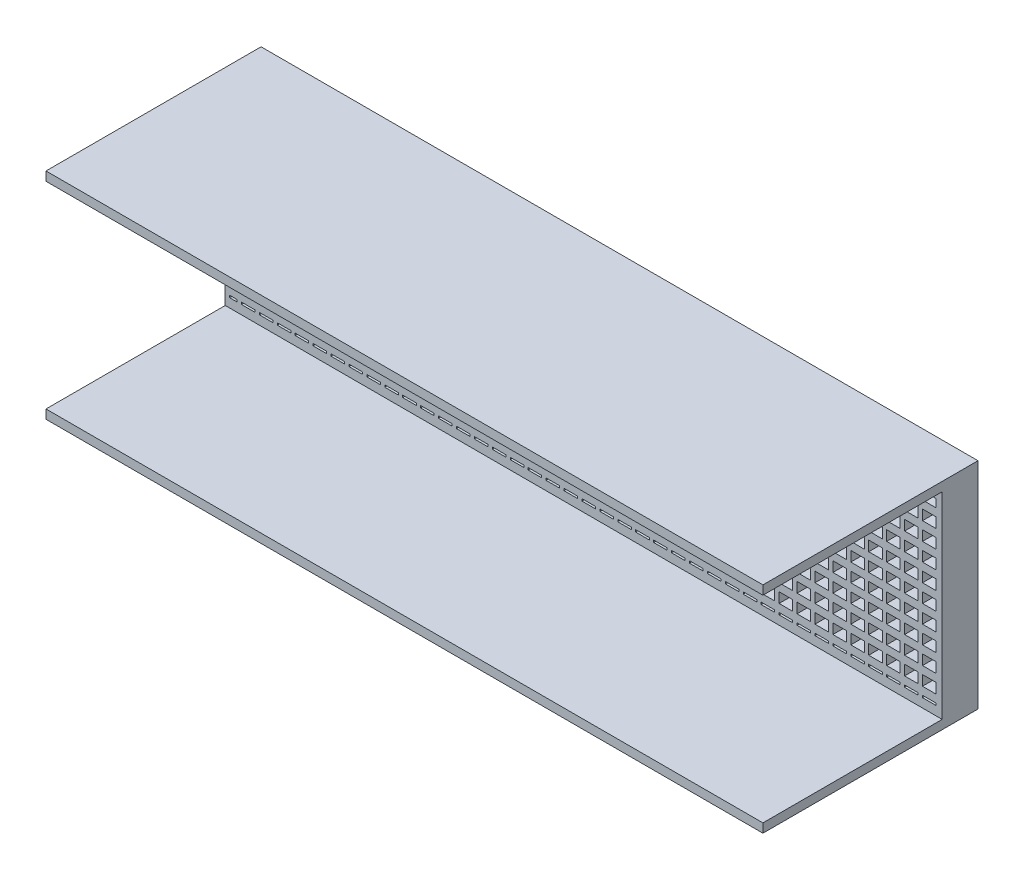
from build123d import *

# Parameters (mm, degrees)
ESQUISSE1_W                  = 400
ESQUISSE1_H                  = 120
ESQUISSE1_W_2                = 395
ESQUISSE1_H_2                = 100
BOSS_EXTRU_1_DEPTH           = 120
ENL_V_MAT_EXTRU_1_DEPTH      = 422.900462195
ENL_V_MAT_EXTRU_1_DEPTH_BACK = 422.900462195
ESQUISSE2_W                  = 100
ESQUISSE2_H                  = 55
ESQUISSE3_W                  = 2.432739123
ESQUISSE3_H                  = 100
BOSS_EXTRU_2_DEPTH           = 20
ESQUISSE4_W                  = 394.097239691
ESQUISSE4_H                  = 4.339946848
BOSS_EXTRU_3_DEPTH           = 20


with BuildPart() as part:
    # Esquisse1 → Boss.-Extru.1 (new body)
    with BuildSketch(Plane.XY):
        Rectangle(ESQUISSE1_W, ESQUISSE1_H)
        Rectangle(ESQUISSE1_W_2, ESQUISSE1_H_2, mode=Mode.SUBTRACT)
    extrude(amount=BOSS_EXTRU_1_DEPTH)

    # Esquisse2 → Enlèv. mat.-Extru.1 (cut, two sides: drawn at the far end of the back side and taken through both)
    with BuildSketch(Plane(origin=(200, 0, 0), x_dir=(0, 0, -1), z_dir=(1, 0, 0)).offset(-ENL_V_MAT_EXTRU_1_DEPTH_BACK)):
        with Locations((-70, -27.5)):
            Rectangle(ESQUISSE2_W, ESQUISSE2_H)
        with Locations((-70, 27.5)):
            Rectangle(ESQUISSE2_W, ESQUISSE2_H)
    extrude(amount=ENL_V_MAT_EXTRU_1_DEPTH + ENL_V_MAT_EXTRU_1_DEPTH_BACK, mode=Mode.SUBTRACT)

    # Esquisse3 → Boss.-Extru.2 (add)
    with BuildSketch(Plane.XY):
        with Locations((-192.186390748, 0)):
            Rectangle(ESQUISSE3_W, ESQUISSE3_H)
        with Locations((-182.186390748, 0)):
            Rectangle(ESQUISSE3_W, ESQUISSE3_H)
        with Locations((-172.186390748, 0)):
            Rectangle(ESQUISSE3_W, ESQUISSE3_H)
        with Locations((-162.186390748, 0)):
            Rectangle(ESQUISSE3_W, ESQUISSE3_H)
        with Locations((-152.186390748, 0)):
            Rectangle(ESQUISSE3_W, ESQUISSE3_H)
        with Locations((-142.186390748, 0)):
            Rectangle(ESQUISSE3_W, ESQUISSE3_H)
        with Locations((-132.186390748, 0)):
            Rectangle(ESQUISSE3_W, ESQUISSE3_H)
        with Locations((-122.186390748, 0)):
            Rectangle(ESQUISSE3_W, ESQUISSE3_H)
        with Locations((-112.186390748, 0)):
            Rectangle(ESQUISSE3_W, ESQUISSE3_H)
        with Locations((-102.186390748, 0)):
            Rectangle(ESQUISSE3_W, ESQUISSE3_H)
        with Locations((-92.186390748, 0)):
            Rectangle(ESQUISSE3_W, ESQUISSE3_H)
        with Locations((-82.186390748, 0)):
            Rectangle(ESQUISSE3_W, ESQUISSE3_H)
        with Locations((-72.186390748, 0)):
            Rectangle(ESQUISSE3_W, ESQUISSE3_H)
        with Locations((-62.186390747, 0)):
            Rectangle(ESQUISSE3_W, ESQUISSE3_H)
        with Locations((-52.186390747, 0)):
            Rectangle(ESQUISSE3_W, ESQUISSE3_H)
        with Locations((-42.186390747, 0)):
            Rectangle(ESQUISSE3_W, ESQUISSE3_H)
        with Locations((-32.186390747, 0)):
            Rectangle(ESQUISSE3_W, ESQUISSE3_H)
        with Locations((-22.186390747, 0)):
            Rectangle(ESQUISSE3_W, ESQUISSE3_H)
        with Locations((-12.186390748, 0)):
            Rectangle(ESQUISSE3_W, ESQUISSE3_H)
        with Locations((-2.186390747, 0)):
            Rectangle(ESQUISSE3_W, ESQUISSE3_H)
        with Locations((7.813609253, 0)):
            Rectangle(ESQUISSE3_W, ESQUISSE3_H)
        with Locations((17.813609253, 0)):
            Rectangle(ESQUISSE3_W, ESQUISSE3_H)
        with Locations((27.813609253, 0)):
            Rectangle(ESQUISSE3_W, ESQUISSE3_H)
        with Locations((37.813609253, 0)):
            Rectangle(ESQUISSE3_W, ESQUISSE3_H)
        with Locations((47.813609253, 0)):
            Rectangle(ESQUISSE3_W, ESQUISSE3_H)
        with Locations((57.813609253, 0)):
            Rectangle(ESQUISSE3_W, ESQUISSE3_H)
        with Locations((67.813609253, 0)):
            Rectangle(ESQUISSE3_W, ESQUISSE3_H)
        with Locations((77.813609253, 0)):
            Rectangle(ESQUISSE3_W, ESQUISSE3_H)
        with Locations((87.813609253, 0)):
            Rectangle(ESQUISSE3_W, ESQUISSE3_H)
        with Locations((97.813609253, 0)):
            Rectangle(ESQUISSE3_W, ESQUISSE3_H)
        with Locations((107.813609253, 0)):
            Rectangle(ESQUISSE3_W, ESQUISSE3_H)
        with Locations((117.813609253, 0)):
            Rectangle(ESQUISSE3_W, ESQUISSE3_H)
        with Locations((127.813609253, 0)):
            Rectangle(ESQUISSE3_W, ESQUISSE3_H)
        with Locations((137.813609252, 0)):
            Rectangle(ESQUISSE3_W, ESQUISSE3_H)
        with Locations((147.813609252, 0)):
            Rectangle(ESQUISSE3_W, ESQUISSE3_H)
        with Locations((157.813609252, 0)):
            Rectangle(ESQUISSE3_W, ESQUISSE3_H)
        with Locations((167.813609252, 0)):
            Rectangle(ESQUISSE3_W, ESQUISSE3_H)
        with Locations((177.813609252, 0)):
            Rectangle(ESQUISSE3_W, ESQUISSE3_H)
        with Locations((187.813609252, 0)):
            Rectangle(ESQUISSE3_W, ESQUISSE3_H)
        with Locations((197.813609252, 0)):
            Rectangle(ESQUISSE3_W, ESQUISSE3_H)
    extrude(amount=BOSS_EXTRU_2_DEPTH)

    # Esquisse4 → Boss.-Extru.3 (add)
    with BuildSketch(Plane.XY):
        with Locations((-0.451380155, 43.353872268)):
            Rectangle(ESQUISSE4_W, ESQUISSE4_H)
        with Locations((-0.451380155, 33.353872268)):
            Rectangle(ESQUISSE4_W, ESQUISSE4_H)
        with Locations((-0.451380155, 23.353872268)):
            Rectangle(ESQUISSE4_W, ESQUISSE4_H)
        with Locations((-0.451380155, 13.353872268)):
            Rectangle(ESQUISSE4_W, ESQUISSE4_H)
        with Locations((-0.451380155, 3.353872268)):
            Rectangle(ESQUISSE4_W, ESQUISSE4_H)
        with Locations((-0.451380155, -6.646127732)):
            Rectangle(ESQUISSE4_W, ESQUISSE4_H)
        with Locations((-0.451380155, -16.646127732)):
            Rectangle(ESQUISSE4_W, ESQUISSE4_H)
        with Locations((-0.451380155, -26.646127732)):
            Rectangle(ESQUISSE4_W, ESQUISSE4_H)
        with Locations((-0.451380155, -36.646127732)):
            Rectangle(ESQUISSE4_W, ESQUISSE4_H)
        with Locations((-0.451380155, -46.646127732)):
            Rectangle(ESQUISSE4_W, ESQUISSE4_H)
    extrude(amount=BOSS_EXTRU_3_DEPTH)


solid = part.part
